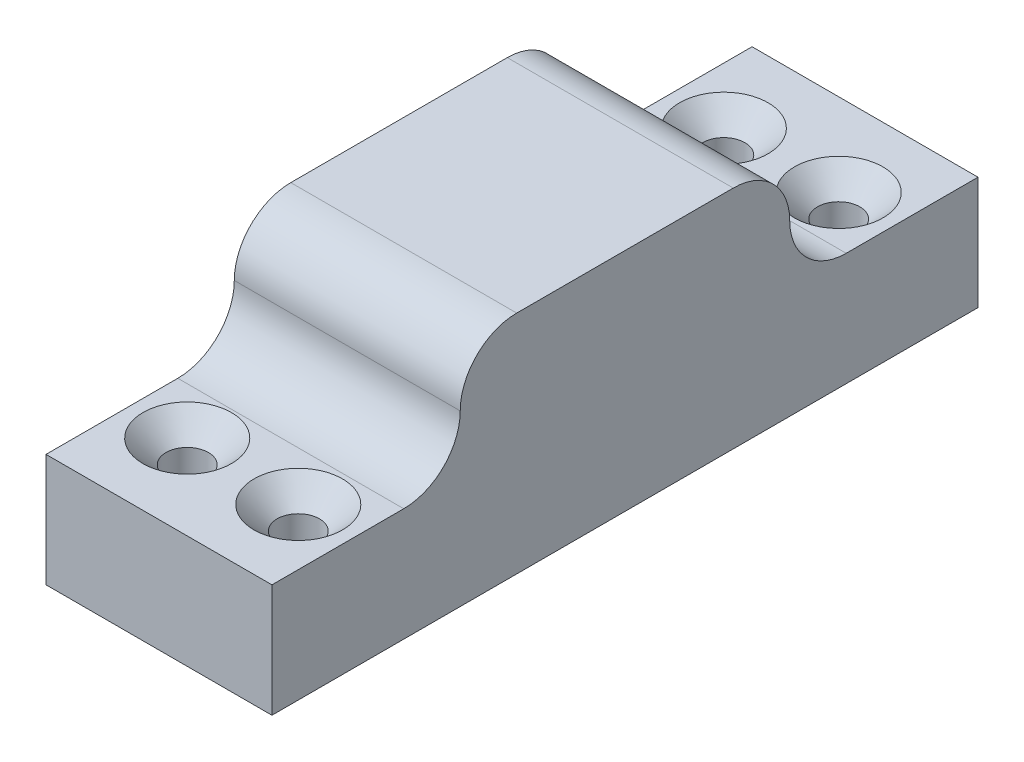
from build123d import *

# Parameters (mm, degrees)
SKETCH1_W                                       = 75
SKETCH1_H                                       = 24
BOSS_EXTRUDE1_DEPTH                             = 24
SKETCH2_W                                       = 20
SKETCH2_H                                       = 12
CUT_EXTRUDE1_DEPTH                              = 24
FILLET1_START                                   = -1
FILLET1_DEPTH                                   = 26
FILLET1_2_DEPTH                                 = 24
CSK_FOR_M4_FLAT_HEAD_MACHINE_SCREW1_D           = 4.5
CSK_FOR_M4_FLAT_HEAD_MACHINE_SCREW1_CSINK_D     = 9.4
CSK_FOR_M4_FLAT_HEAD_MACHINE_SCREW1_CSINK_ANGLE = 90


with BuildPart() as part:
    # Sketch1 → Boss-Extrude1 (new body)
    with BuildSketch(Plane(origin=(0, 0, 0), x_dir=(0, 0, -1), z_dir=(1, 0, 0))):
        Rectangle(SKETCH1_W, SKETCH1_H)
    extrude(amount=BOSS_EXTRUDE1_DEPTH)

    # Sketch2 → Cut-Extrude1 (cut)
    with BuildSketch(Plane(origin=(24, 0, 0), x_dir=(0, 0, -1), z_dir=(1, 0, 0))):
        with Locations((-27.5, 6)):
            Rectangle(SKETCH2_W, SKETCH2_H)
    cut_extrude1 = extrude(amount=-CUT_EXTRUDE1_DEPTH, mode=Mode.SUBTRACT)

    # Fillet1: read off the stored shape, not the designer's step
    # Fillet1 outline → Fillet1 (cut)
    with BuildSketch(Plane.YZ.offset(FILLET1_START)):
        with BuildLine():
            Line((12, 17.5), (6, 17.5))
            ThreePointArc((6, 17.5), (10.242640687, 15.742640687), (12, 11.5))
            Line((12, 11.5), (12, 17.5))
        make_face()
    fillet1 = extrude(amount=FILLET1_DEPTH, mode=Mode.SUBTRACT)

    # Fillet1 2 outline → Fillet1 2 (add)
    with BuildSketch(Plane.YZ):
        with BuildLine():
            Line((0, 17.5), (6, 17.5))
            ThreePointArc((6, 17.5), (1.757359313, 19.257359313), (0, 23.5))
            Line((0, 23.5), (0, 17.5))
        make_face()
    fillet1_2 = extrude(amount=FILLET1_2_DEPTH)

    # CSK for M4 Flat Head Machine Screw1 (through all)
    with Locations(Plane(origin=(0, 0, 0), x_dir=(1, 0, 0), z_dir=(0, 1, 0))):
        with Locations((6, -28.5), (18, -28.702489343)):
            csk_for_m4_flat_head_machine_screw1 = CounterSinkHole(CSK_FOR_M4_FLAT_HEAD_MACHINE_SCREW1_D / 2, CSK_FOR_M4_FLAT_HEAD_MACHINE_SCREW1_CSINK_D / 2, counter_sink_angle=CSK_FOR_M4_FLAT_HEAD_MACHINE_SCREW1_CSINK_ANGLE)

    # Mirror1: Cut-Extrude1, Fillet1, Fillet1 2, CSK for M4 Flat Head Machine Screw1 across plane
    add(cut_extrude1.mirror(Plane.XY), mode=Mode.SUBTRACT)
    add(fillet1.mirror(Plane.XY), mode=Mode.SUBTRACT)
    add(fillet1_2.mirror(Plane.XY))
    add(csk_for_m4_flat_head_machine_screw1.mirror(Plane.XY), mode=Mode.SUBTRACT)


solid = part.part
